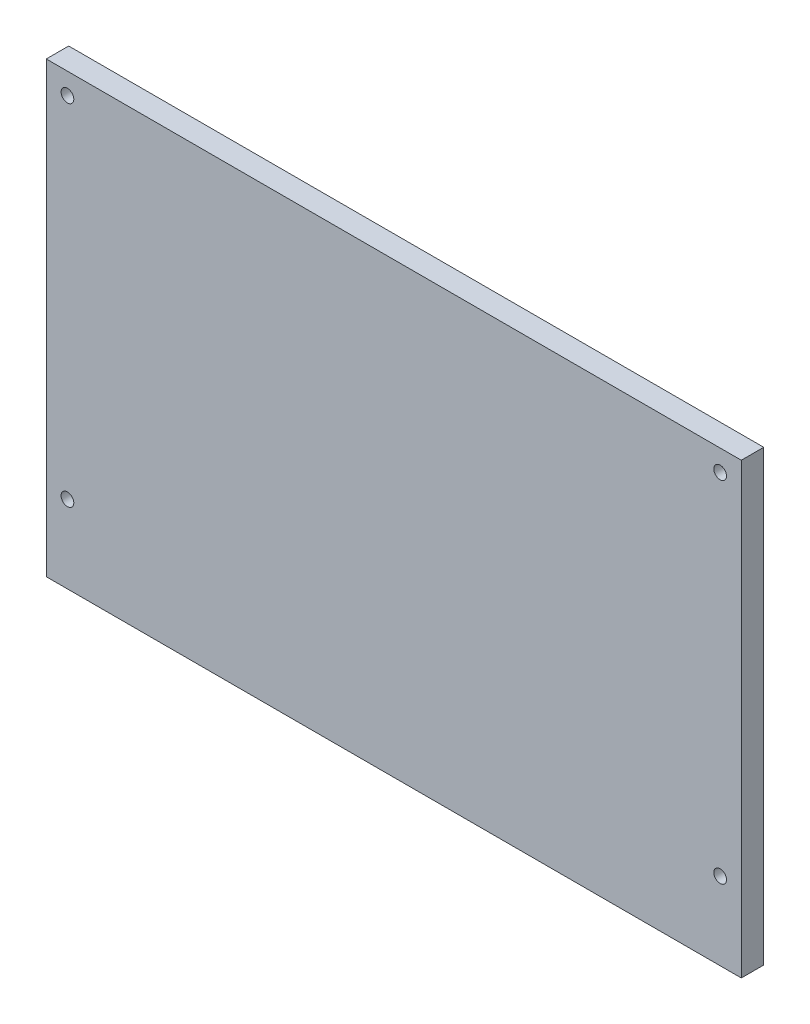
from build123d import *

# Parameters (mm, degrees)
SKETCH1_W            = 196.85
SKETCH1_H            = 127
BOSS_EXTRUDE1_DEPTH  = 6.35
M3_CLEARANCE_HOLE1_D = 3.6


with BuildPart() as part:
    # Sketch1 → Boss-Extrude1 (new body)
    with BuildSketch(Plane.XY):
        with Locations((98.425, 63.5)):
            Rectangle(SKETCH1_W, SKETCH1_H)
    extrude(amount=BOSS_EXTRUDE1_DEPTH)

    # M3 Clearance Hole1 (through all)
    with Locations(Plane.XY.offset(6.35)):
        with Locations((5.9944, 121.0056), (5.9944, 21.9964), (190.8556, 21.9964), (190.8556, 121.0056)):
            Hole(M3_CLEARANCE_HOLE1_D / 2)


solid = part.part
